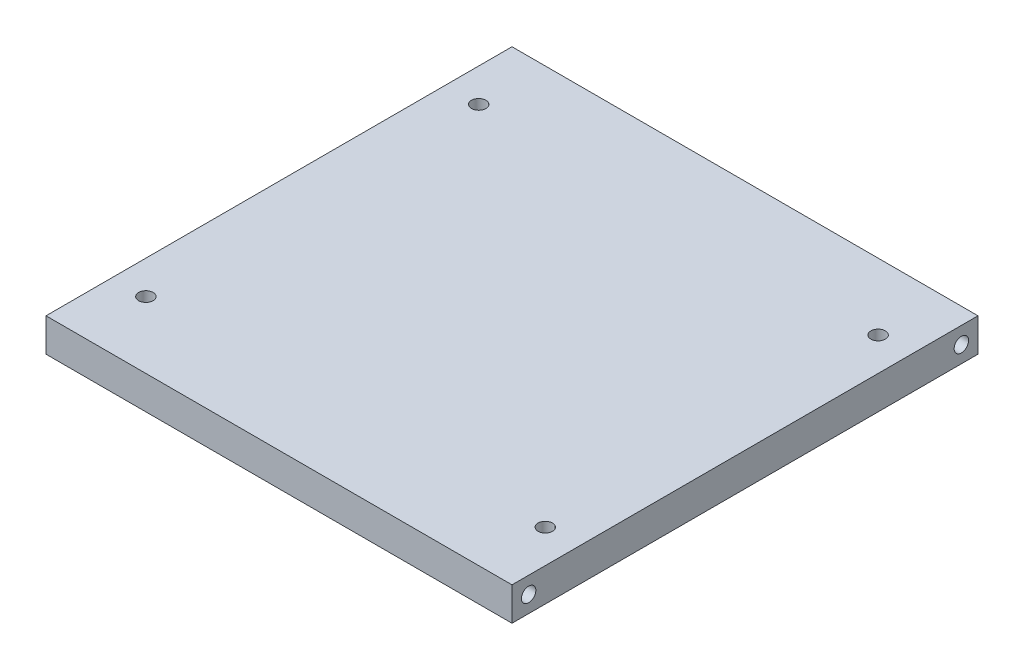
from build123d import *

# Parameters (mm, degrees)
SKETCH1_W            = 84
SKETCH1_H            = 84
BOSS_EXTRUDE1_DEPTH  = 6
SKETCH2_R            = 1.3
CUT_EXTRUDE1_DEPTH   = 6
LPATTERN1_COUNT      = 2
LPATTERN1_PITCH      = 72
LPATTERN1_COUNT_DIR2 = 2
LPATTERN1_PITCH_DIR2 = 60
SKETCH3_R            = 1.3
CUT_EXTRUDE2_DEPTH   = 10


with BuildPart() as part:
    # Sketch1 → Boss-Extrude1 (new body)
    with BuildSketch(Plane(origin=(0, 0, 0), x_dir=(1, 0, 0), z_dir=(0, 1, 0))):
        with Locations((42, 42)):
            Rectangle(SKETCH1_W, SKETCH1_H)
    extrude(amount=BOSS_EXTRUDE1_DEPTH)

    # Sketch2 → Cut-Extrude1 (cut)
    with BuildSketch(Plane(origin=(0, 6, 0), x_dir=(1, 0, 0), z_dir=(0, 1, 0))):
        with Locations((6, 72)):
            Circle(SKETCH2_R)
    cut_extrude1 = extrude(amount=-CUT_EXTRUDE1_DEPTH, mode=Mode.SUBTRACT)

    # LPattern1: Cut-Extrude1 2 × 2
    with Locations(*[(i * LPATTERN1_PITCH, 0, j * LPATTERN1_PITCH_DIR2) for i in range(LPATTERN1_COUNT) for j in range(LPATTERN1_COUNT_DIR2) if (i, j) != (0, 0)]):
        add(cut_extrude1, mode=Mode.SUBTRACT)

    # Sketch3 → Cut-Extrude2 (cut)
    with BuildSketch(Plane.ZY):
        with Locations((-81, 3)):
            Circle(SKETCH3_R)
        with Locations((-3, 3)):
            Circle(SKETCH3_R)
    cut_extrude2 = extrude(amount=-CUT_EXTRUDE2_DEPTH, mode=Mode.SUBTRACT)

    # Mirror1: Cut-Extrude2 across plane
    add(cut_extrude2.mirror(Plane.ZY.offset(-42)), mode=Mode.SUBTRACT)


solid = part.part
